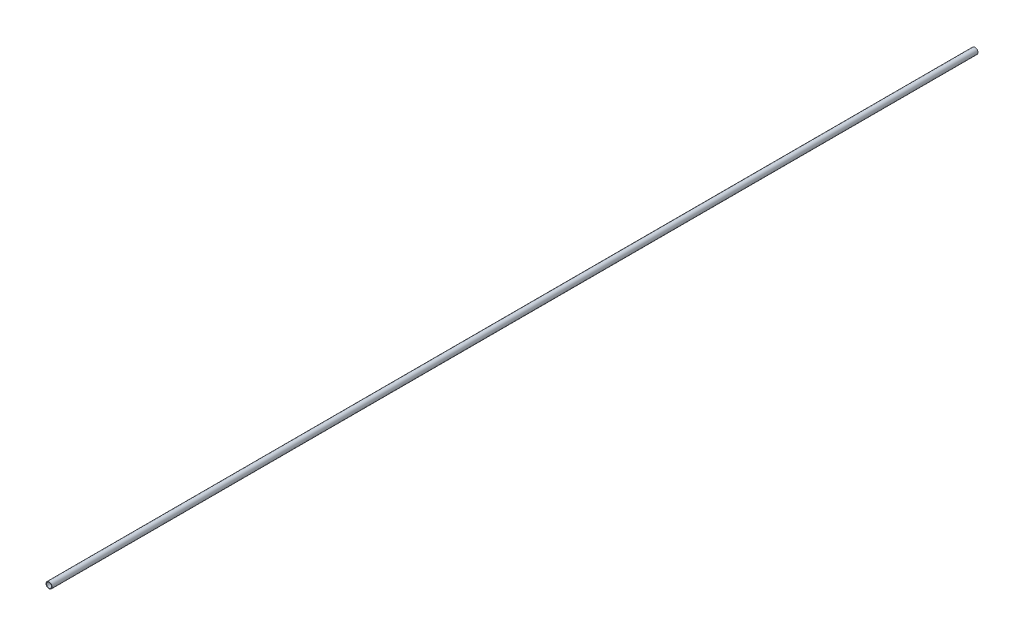
from build123d import *

# Parameters (mm, degrees)
SKETCH1_R           = 3
SKETCH1_R_2         = 2.5
BOSS_EXTRUDE1_DEPTH = 457.2


with BuildPart() as part:
    # Sketch1 → Boss-Extrude1 (new, symmetric)
    with BuildSketch(Plane.XY):
        Circle(SKETCH1_R)
        Circle(SKETCH1_R_2, mode=Mode.SUBTRACT)
    extrude(amount=BOSS_EXTRUDE1_DEPTH, both=True)


solid = part.part
